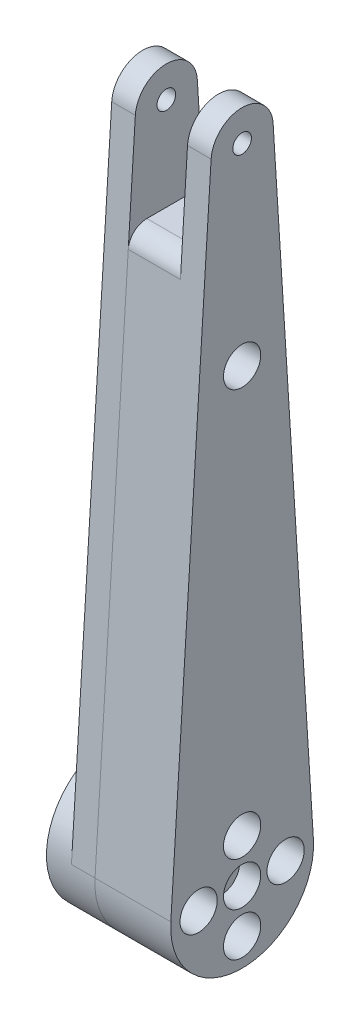
from build123d import *

# Parameters (mm, degrees)
SKETCH1_R                                           = 1.5
SKETCH1_R_2                                         = 1.6
BOSS_EXTRUDE1_DEPTH                                 = 16
BOSS_EXTRUDE2_START                                 = -4
SKETCH1_4_R                                         = 10.25
BOSS_EXTRUDE2_DEPTH                                 = 4
BOSS_EXTRUDE3_START                                 = -2
SKETCH1_5_R                                         = 10.25
SKETCH1_5_R_2                                       = 1.6
BOSS_EXTRUDE3_DEPTH                                 = 2
CBORE_FOR_M3_HEX_SOCKET_HEAD_CAP_SCREW1_D           = 3.4
CBORE_FOR_M3_HEX_SOCKET_HEAD_CAP_SCREW1_CBORE_D     = 6
CBORE_FOR_M3_HEX_SOCKET_HEAD_CAP_SCREW1_CBORE_DEPTH = 12
CIRPATTERN2_COUNT                                   = 4
SKETCH4_R                                           = 3
CUT_EXTRUDE2_DEPTH                                  = 3.4
CUT_EXTRUDE5_DEPTH                                  = 111.274657107
CUT_EXTRUDE5_DEPTH_BACK                             = 111.274657107
SKETCH6_W                                           = 8.4
SKETCH6_H                                           = 20
FILLET1_R                                           = 3


with BuildPart() as part:
    # Sketch1 → Boss-Extrude1 (new body)
    with BuildSketch(Plane(origin=(0, 0, 0), x_dir=(0, 0, -1), z_dir=(1, 0, 0))):
        with BuildLine():
            Line((-4.990130052, 103.814009662), (-11.477299119, 0.722222222))
            ThreePointArc((-11.477299119, 0.722222222), (0, -11.5), (11.477299119, 0.722222222))
            Line((11.477299119, 0.722222222), (4.990130052, 103.814009662))
            ThreePointArc((4.990130052, 103.814009662), (0, 108.5), (-4.990130052, 103.814009662))
        make_face()
        with Locations((0, 103.5)):
            Circle(SKETCH1_R, mode=Mode.SUBTRACT)
        Circle(SKETCH1_R_2, mode=Mode.SUBTRACT)
    extrude(amount=BOSS_EXTRUDE1_DEPTH)

    # Sketch1<4> → Boss-Extrude2 (add)
    with BuildSketch(Plane(origin=(0, 0, 0), x_dir=(0, 0, -1), z_dir=(1, 0, 0)).offset(BOSS_EXTRUDE2_START)):
        with BuildLine():
            ThreePointArc((11.5, 0), (11.494323379, 0.361289451), (11.477299119, 0.722222222))
            ThreePointArc((11.477299119, 0.722222222), (0, 11.5), (-11.477299119, 0.722222222))
            ThreePointArc((-11.477299119, 0.722222222), (-0.361289451, -11.494323379), (11.5, 0))
        make_face()
        Circle(SKETCH1_4_R, mode=Mode.SUBTRACT)
    extrude(amount=BOSS_EXTRUDE2_DEPTH)

    # Sketch1<5> → Boss-Extrude3 (add)
    with BuildSketch(Plane(origin=(0, 0, 0), x_dir=(0, 0, -1), z_dir=(1, 0, 0)).offset(BOSS_EXTRUDE3_START)):
        Circle(SKETCH1_5_R)
        Circle(SKETCH1_5_R_2, mode=Mode.SUBTRACT)
    extrude(amount=BOSS_EXTRUDE3_DEPTH)

    # CBORE for M3 Hex Socket Head Cap Screw1 (through all)
    with Locations(Plane(origin=(16, 0, 0), x_dir=(0, 0, -1), z_dir=(1, 0, 0))):
        with Locations((0, 7)):
            cbore_for_m3_hex_socket_head_cap_screw1 = CounterBoreHole(CBORE_FOR_M3_HEX_SOCKET_HEAD_CAP_SCREW1_D / 2, CBORE_FOR_M3_HEX_SOCKET_HEAD_CAP_SCREW1_CBORE_D / 2, CBORE_FOR_M3_HEX_SOCKET_HEAD_CAP_SCREW1_CBORE_DEPTH)

    # CirPattern2: CBORE for M3 Hex Socket Head Cap Screw1 ×4 about axis
    cirpattern2_axis = Axis((-4, 0, 0), (1, 0, 0))
    for i in range(1, CIRPATTERN2_COUNT):
        add(cbore_for_m3_hex_socket_head_cap_screw1.rotate(cirpattern2_axis, i * 360 / CIRPATTERN2_COUNT), mode=Mode.SUBTRACT)

    # Sketch4 → Cut-Extrude2 (cut)
    with BuildSketch(Plane(origin=(16, 0, 0), x_dir=(0, 0, -1), z_dir=(1, 0, 0))):
        Circle(SKETCH4_R)
    extrude(amount=-CUT_EXTRUDE2_DEPTH, mode=Mode.SUBTRACT)

    # Sketch6 → Cut-Extrude5 (cut, two sides: drawn at the far end of the back side and taken through both)
    with BuildSketch(Plane.XY.offset(-CUT_EXTRUDE5_DEPTH_BACK)):
        with Locations((8, 98.5)):
            Rectangle(SKETCH6_W, SKETCH6_H)
    extrude(amount=CUT_EXTRUDE5_DEPTH + CUT_EXTRUDE5_DEPTH_BACK, mode=Mode.SUBTRACT)

    # Fillet1
    fillet1_edges = [part.edges().sort_by_distance(p)[0] for p in [
        (8, 88.5, -5.953781689),
        (8, 88.5, 5.953781689),
    ]]
    fillet(fillet1_edges, radius=FILLET1_R)


with BuildPart() as body_2:
    # Split1: the piece on the far side of the plane
    add(part.part)
    split(bisect_by=Plane.YZ.offset(3.8), keep=Keep.BOTTOM)


with BuildPart() as part_1:
    add(part.part)

    # Split1
    split(bisect_by=Plane.YZ.offset(3.8), keep=Keep.TOP)


with BuildPart() as cbore_for_m3_hex_socket_head_cap_screw2_tool:
    # Sketch8 → CBORE for M3 Hex Socket Head Cap Screw2 (revolve)
    with BuildSketch(Plane(origin=(16, 72.5, 0), x_dir=(0, 0, -1), z_dir=(0, 1, 0))):
        Polygon((0, 0), (0, 20), (1.5, 20), (1.5, 8), (3, 8), (3, 0), align=None)
    revolve(axis=Axis((22.35, 72.5, 0), (-1, 0, 0)))


with BuildPart() as part_2:
    add(part_1.part)

    # CBORE for M3 Hex Socket Head Cap Screw2: cut by cbore_for_m3_hex_socket_head_cap_screw2_tool
    add(cbore_for_m3_hex_socket_head_cap_screw2_tool.part, mode=Mode.SUBTRACT)


with BuildPart() as body_2_1:
    add(body_2.part)

    # CBORE for M3 Hex Socket Head Cap Screw2: cut by cbore_for_m3_hex_socket_head_cap_screw2_tool
    add(cbore_for_m3_hex_socket_head_cap_screw2_tool.part, mode=Mode.SUBTRACT)


solid = Compound([part_2.part, body_2_1.part])
